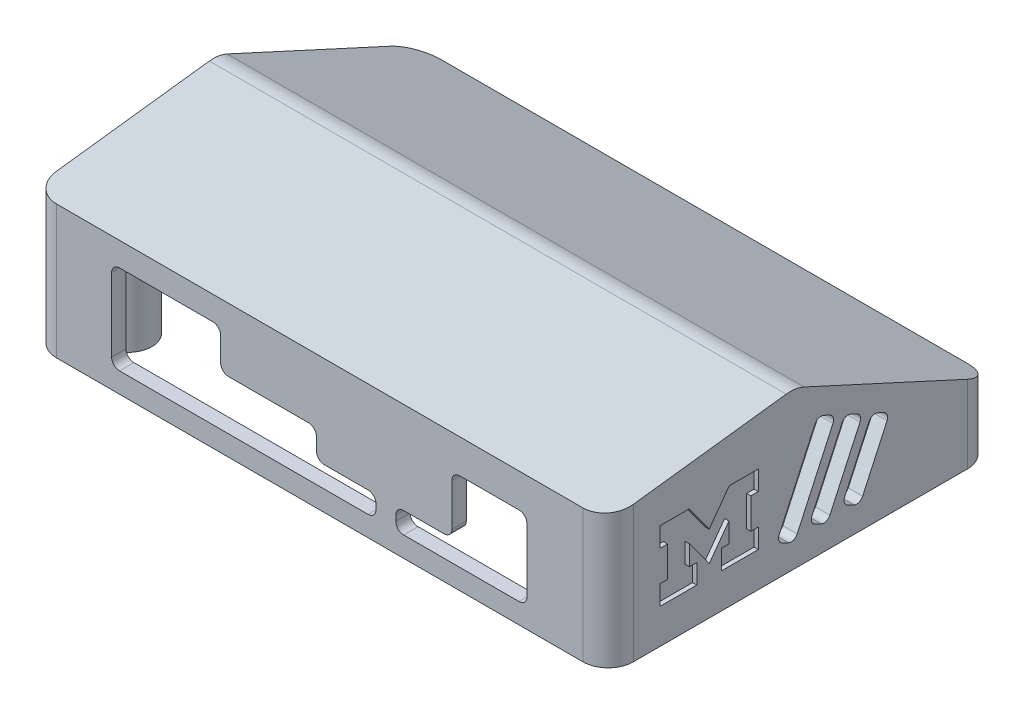
from build123d import *

# Parameters (mm, degrees)
BOSS_EXTRUDE1_DEPTH  = 1.8
BOSS_EXTRUDE3_DEPTH  = 10
CUT_EXTRUDE1_START   = -2.175
CUT_EXTRUDE1_DEPTH   = 2.175
SKETCH5_R            = 2.19
CUT_EXTRUDE2_DEPTH   = 5
BOSS_EXTRUDE4_DEPTH  = 8
BOSS_EXTRUDE5_DEPTH  = 2.175
SKETCH15_W           = 8.25
SKETCH15_H           = 13.5
SKETCH15_W_2         = 8.509
SKETCH15_H_2         = 3.2
SKETCH15_W_3         = 0.491
SKETCH15_W_4         = 5.25
SKETCH15_H_3         = 12
CUT_EXTRUDE3_DEPTH   = 2.175
BOSS_EXTRUDE11_REACH = 97.681
BOSS_EXTRUDE12_DEPTH = 2.175
BOSS_EXTRUDE13_DEPTH = 2.175
CUT_EXTRUDE6_DEPTH   = 97.550219411
FILLET7_R            = 1
FILLET1_R            = 3.8
FILLET2_R            = 3.8
FILLET4_R            = 1.2
BOSS_EXTRUDE9_REACH  = 68.419
BOSS_EXTRUDE9_START  = -3.13
SKETCH20_R           = 3.6
SKETCH20_R_2         = 2.125
CUT_EXTRUDE4_DEPTH   = 97.550219411
SKETCH23_W           = 8.6
SKETCH23_H           = 1.5
SKETCH23_W_2         = 3.9
CUT_EXTRUDE5_DEPTH   = 2.175
BOSS_EXTRUDE14_REACH = 68.419
BOSS_EXTRUDE14_START = -3.13
SKETCH20_4_R         = 3.6
SKETCH20_4_R_2       = 2.125
FILLET8_R            = 5
CUT_EXTRUDE7_DEPTH   = 0.65
BOSS_EXTRUDE16_REACH = 64.045
BOSS_EXTRUDE17_REACH = 64.045


# Read off the part's stored shape, not the designer's step: Cut-Extrude1
with BuildPart() as part:
    # Sketch1 → Boss-Extrude1 (new body)
    with BuildSketch(Plane(origin=(0, 0, 0), x_dir=(1, 0, 0), z_dir=(0, 1, 0))):
        with BuildLine():
            Line((-37.776666667, 21.111111111), (-37.776666667, -27.738888889))
            ThreePointArc((-37.776666667, -27.738888889), (-36.851124095, -29.973346317), (-34.616666667, -30.898888889))
            Line((-34.616666667, -30.898888889), (43.333333333, -30.898888889))
            ThreePointArc((43.333333333, -30.898888889), (45.567790762, -29.973346317), (46.493333333, -27.738888889))
            Line((46.493333333, -27.738888889), (46.493333333, 21.111111111))
            ThreePointArc((46.493333333, 21.111111111), (45.567790762, 23.34556854), (43.333333333, 24.271111111))
            Line((43.333333333, 24.271111111), (-34.616666667, 24.271111111))
            ThreePointArc((-34.616666667, 24.271111111), (-36.851124095, 23.34556854), (-37.776666667, 21.111111111))
        make_face()
        with BuildLine():
            Line((-34.616666667, 23.611111111), (43.333333333, 23.611111111))
            ThreePointArc((43.333333333, 23.611111111), (45.101100286, 22.878878064), (45.833333333, 21.111111111))
            Line((45.833333333, 21.111111111), (45.833333333, -27.738888889))
            ThreePointArc((45.833333333, -27.738888889), (45.101100286, -29.506655842), (43.333333333, -30.238888889))
            Line((43.333333333, -30.238888889), (-34.616666667, -30.238888889))
            ThreePointArc((-34.616666667, -30.238888889), (-36.38443362, -29.506655842), (-37.116666667, -27.738888889))
            Line((-37.116666667, -27.738888889), (-37.116666667, 21.111111111))
            ThreePointArc((-37.116666667, 21.111111111), (-36.38443362, 22.878878064), (-34.616666667, 23.611111111))
        make_face(mode=Mode.SUBTRACT)
    extrude(amount=BOSS_EXTRUDE1_DEPTH)

    # Sketch3 → Boss-Extrude3 (add)
    with BuildSketch(Plane(origin=(0, 1.8, 0), x_dir=(1, 0, 0), z_dir=(0, 1, 0))):
        Polygon((-34.616666667, 25.786111111), (-39.291666667, 25.786111111), (-39.291666667, -32.413888889), (48.008333333, -32.413888889), (48.008333333, 25.786111111), align=None)
        with BuildLine():
            Line((-37.116666667, -27.738888889), (-37.116666667, 21.111111111))
            ThreePointArc((-37.116666667, 21.111111111), (-36.38443362, 22.878878064), (-34.616666667, 23.611111111))
            Line((-34.616666667, 23.611111111), (43.333333333, 23.611111111))
            ThreePointArc((43.333333333, 23.611111111), (45.101100286, 22.878878064), (45.833333333, 21.111111111))
            Line((45.833333333, 21.111111111), (45.833333333, -27.738888889))
            ThreePointArc((45.833333333, -27.738888889), (45.101100286, -29.506655842), (43.333333333, -30.238888889))
            Line((43.333333333, -30.238888889), (-34.616666667, -30.238888889))
            ThreePointArc((-34.616666667, -30.238888889), (-36.38443362, -29.506655842), (-37.116666667, -27.738888889))
        make_face(mode=Mode.SUBTRACT)
    extrude(amount=BOSS_EXTRUDE3_DEPTH)

    # Cut-Extrude1 outline → Cut-Extrude1 (cut)
    with BuildSketch(Plane(origin=(0, 0, -25.786111111), x_dir=(-1, 0, 0), z_dir=(0, 0, -1)).offset(CUT_EXTRUDE1_START)):
        with BuildLine():
            ThreePointArc((11.403122186, 1.8), (7.960666667, 10.45), (4.518211148, 1.8))
            Line((4.518211148, 1.8), (4.518211148, 0))
            Line((4.518211148, 0), (11.403122186, 0))
            Line((11.403122186, 0), (11.403122186, 1.8))
        make_face()
        with BuildLine():
            Line((24.104122186, 0), (24.104122186, 1.8))
            ThreePointArc((24.104122186, 1.8), (20.661666667, 10.45), (17.219211148, 1.8))
            Line((17.219211148, 1.8), (17.219211148, 0))
            Line((17.219211148, 0), (24.104122186, 0))
        make_face()
    extrude(amount=CUT_EXTRUDE1_DEPTH, mode=Mode.SUBTRACT)

    # Sketch5 → Cut-Extrude2 (cut)
    with BuildSketch(Plane(origin=(0, 0, -25.786111111), x_dir=(-1, 0, 0), z_dir=(0, 0, -1))):
        with Locations((-17.338333333, 8.55)):
            Circle(SKETCH5_R)
        with Locations((-4.658333333, 8.55)):
            Circle(SKETCH5_R)
    extrude(amount=-CUT_EXTRUDE2_DEPTH, mode=Mode.SUBTRACT)

    # Sketch6 → Boss-Extrude4 (add)
    with BuildSketch(Plane(origin=(0, 11.8, 0), x_dir=(1, 0, 0), z_dir=(0, 1, 0))):
        with BuildLine():
            Line((-37.116666667, -27.738888889), (-37.116666667, -3.313888889))
            Line((-37.116666667, -3.313888889), (-39.291666667, -3.313888889))
            Line((-39.291666667, -3.313888889), (-39.291666667, -28.613888889))
            Line((-39.291666667, -28.613888889), (-39.291666667, -32.413888889))
            Line((-39.291666667, -32.413888889), (-35.491666667, -32.413888889))
            Line((-35.491666667, -32.413888889), (44.208333333, -32.413888889))
            Line((44.208333333, -32.413888889), (48.008333333, -32.413888889))
            Line((48.008333333, -32.413888889), (48.008333333, -28.613888889))
            Line((48.008333333, -28.613888889), (48.008333333, -3.313888889))
            Line((48.008333333, -3.313888889), (45.833333333, -3.313888889))
            Line((45.833333333, -3.313888889), (45.833333333, -27.738888889))
            ThreePointArc((45.833333333, -27.738888889), (45.101100286, -29.506655842), (43.333333333, -30.238888889))
            Line((43.333333333, -30.238888889), (-34.616666667, -30.238888889))
            ThreePointArc((-34.616666667, -30.238888889), (-36.38443362, -29.506655842), (-37.116666667, -27.738888889))
        make_face()
    extrude(amount=BOSS_EXTRUDE4_DEPTH)

    # Sketch7 → Boss-Extrude5 (add)
    with BuildSketch(Plane(origin=(0, 19.8, 0), x_dir=(1, 0, 0), z_dir=(0, 1, 0))):
        Polygon((-39.291666667, -30.238888889), (48.008333333, -30.238888889), (48.008333333, -31.3687594), (48.008333333, -32.413888889), (44.208333333, -32.413888889), (-35.491666667, -32.413888889), (-39.291666667, -32.413888889), (-39.291666667, -31.3687594), align=None)
    extrude(amount=BOSS_EXTRUDE5_DEPTH)

    # Sketch15 → Cut-Extrude3 (cut)
    with BuildSketch(Plane.XY.offset(32.413888889)):
        with Locations((-23.007666667, 11.6175)):
            Rectangle(SKETCH15_W, SKETCH15_H)
        Polygon((-18.882666667, 4.8675), (-10.632666667, 4.8675), (-10.632666667, 12.3675), (-10.632666667, 18.3675), (-18.882666667, 18.3675), align=None)
        Polygon((-10.632666667, 4.8675), (3.867333333, 4.8675), (3.867333333, 8.0675), (3.867333333, 12.3675), (-10.632666667, 12.3675), align=None)
        with Locations((8.612833333, 6.4675)):
            Rectangle(SKETCH15_W_2, SKETCH15_H_2)
        with Locations((4.112833333, 6.4675)):
            Rectangle(SKETCH15_W_3, SKETCH15_H_2)
        Polygon((15.867333333, 8.0675), (15.867333333, 4.8675), (24.367333333, 4.8675), (25.219533333, 4.8675), (30.469533333, 4.8675), (30.469533333, 16.8675), (25.219533333, 16.8675), (24.367333333, 16.8675), (24.367333333, 8.0675), align=None)
        with Locations((33.094533333, 10.8675)):
            Rectangle(SKETCH15_W_4, SKETCH15_H_3)
        with Locations((33.094533333, 10.8675)):
            Rectangle(SKETCH15_W_4, SKETCH15_H_3)
    extrude(amount=-CUT_EXTRUDE3_DEPTH, mode=Mode.SUBTRACT)

    # Boss-Extrude11: up to this face of the body (flat: up to its plane)
    boss_extrude11_end = Plane(part.part.faces().sort_by_distance((48.008333333, 9.43790347, 7.608733432))[0])
    # Sketch24 → Boss-Extrude11 (add, up to the picked face)
    with BuildSketch(Plane.ZY.offset(39.291666667), mode=Mode.PRIVATE) as boss_extrude11_sk1:
        Polygon((32.146007123, 19.816559739), (4.397287352, 23.26042436), (-20.572039568, 11.8), (-25.786111111, 11.8), (4.051768383, 25.494993145), (32.413888889, 21.975), (32.413888889, 19.816559739), align=None)
    boss_extrude11_tool1 = split(extrude(boss_extrude11_sk1.sketch, amount=-BOSS_EXTRUDE11_REACH, mode=Mode.PRIVATE), bisect_by=boss_extrude11_end, keep=Keep.BOTH, mode=Mode.PRIVATE)
    add(boss_extrude11_tool1.solids().sort_by(Axis((-39.291667, 22.131836, 18.345286), (1, 0, 0)))[0])

    # Sketch28 → Boss-Extrude12 (add)
    with BuildSketch(Plane.ZY.offset(39.291666667)):
        Polygon((-20.572039568, 11.8), (4.397287352, 23.26042436), (30.238888889, 20.053250191), (30.238888889, 19.8), (3.313888889, 19.8), (3.313888889, 11.8), align=None)
    extrude(amount=-BOSS_EXTRUDE12_DEPTH)

    # Sketch29 → Boss-Extrude13 (add)
    with BuildSketch(Plane(origin=(48.008333333, 0, 0), x_dir=(0, 0, -1), z_dir=(1, 0, 0))):
        Polygon((-30.238888889, 20.053250191), (-30.238888889, 19.8), (-3.313888889, 19.8), (-3.313888889, 11.8), (20.572039568, 11.8), (-4.397287352, 23.26042436), align=None)
    extrude(amount=-BOSS_EXTRUDE13_DEPTH)

    # Sketch32 → Cut-Extrude6 (cut, through all)
    with BuildSketch(Plane(origin=(48.008333333, 0, 0), x_dir=(0, 0, -1), z_dir=(1, 0, 0))):
        Polygon((2.025914345, 18.864684215), (-0.7006118, 20.116105479), (-6.946522085, 6.507868042), (-4.21999594, 5.256446778), align=None)
        Polygon((0.731359478, 5.256446778), (6.115703563, 16.98755232), (3.389177418, 18.238973584), (-1.995166668, 6.507868042), align=None)
        Polygon((2.95618875, 6.507868042), (7.478966636, 16.361841688), (10.205492781, 15.110420424), (5.682714895, 5.256446778), align=None)
    extrude(amount=-CUT_EXTRUDE6_DEPTH, mode=Mode.SUBTRACT)

    # Fillet7
    fillet7_edges = [part.edges().sort_by_distance(p)[0] for p in [
        (46.920833333, 18.864684215, -2.025914345),
        (46.920833333, 5.256446778, 4.21999594),
        (46.920833333, 6.507868042, 6.946522085),
        (46.920833333, 20.116105479, 0.7006118),
        (-38.204166667, 18.864684215, -2.025914345),
        (-38.204166667, 5.256446778, 4.21999594),
        (-38.204166667, 6.507868042, 6.946522085),
        (-38.204166667, 20.116105479, 0.7006118),
        (46.920833333, 16.98755232, -6.115703563),
        (46.920833333, 5.256446778, -0.731359478),
        (46.920833333, 6.507868042, 1.995166668),
        (46.920833333, 18.238973584, -3.389177418),
        (-38.204166667, 16.98755232, -6.115703563),
        (-38.204166667, 5.256446778, -0.731359478),
        (-38.204166667, 6.507868042, 1.995166668),
        (-38.204166667, 18.238973584, -3.389177418),
        (46.920833333, 6.507868042, -2.95618875),
        (46.920833333, 16.361841688, -7.478966636),
        (46.920833333, 15.110420424, -10.205492781),
        (46.920833333, 5.256446778, -5.682714895),
        (-38.204166667, 6.507868042, -2.95618875),
        (-38.204166667, 16.361841688, -7.478966636),
        (-38.204166667, 15.110420424, -10.205492781),
        (-38.204166667, 5.256446778, -5.682714895),
    ]]
    fillet(fillet7_edges, radius=FILLET7_R)

    # Fillet1
    fillet1_edges = [part.edges().sort_by_distance(p)[0] for p in [
        (-39.291666667, 11.8875, 32.413888889),
        (48.008333333, 11.8875, 32.413888889),
    ]]
    fillet(fillet1_edges, radius=FILLET1_R)

    # Fillet2
    fillet2_edges = [part.edges().sort_by_distance(p)[0] for p in [
        (-39.291666667, 6.8, -25.786111111),
        (48.008333333, 6.8, -25.786111111),
    ]]
    fillet(fillet2_edges, radius=FILLET2_R)

    # Fillet4
    fillet4_edges = [part.edges().sort_by_distance(p)[0] for p in [
        (-27.132666667, 18.3675, 31.326388889),
        (-10.632666667, 18.3675, 31.326388889),
        (-10.632666667, 12.3675, 31.326388889),
        (3.867333333, 12.3675, 31.326388889),
        (3.867333333, 8.0675, 31.326388889),
        (12.867333333, 8.0675, 31.326388889),
        (12.867333333, 4.8675, 31.326388889),
        (-27.132666667, 4.8675, 31.326388889),
        (35.719533333, 4.8675, 31.326388889),
        (15.867333333, 4.8675, 31.326388889),
        (15.867333333, 8.0675, 31.326388889),
        (24.367333333, 8.0675, 31.326388889),
        (24.367333333, 16.8675, 31.326388889),
        (35.719533333, 16.8675, 31.326388889),
    ]]
    fillet(fillet4_edges, radius=FILLET4_R)

    # Boss-Extrude9: up to this plane
    boss_extrude9_end = Plane(origin=(107.797904642, 19.816559739, 32.146007123), z_dir=(0, -0.9923863268188609, -0.12316403023192016))
    # Sketch20 → Boss-Extrude9 (add, up to the surface)
    with BuildSketch(Plane.XZ.offset(BOSS_EXTRUDE9_START), mode=Mode.PRIVATE) as boss_extrude9_sk1:
        with Locations(Location((40.708333333, 25.063888889, 0), (0, 0, 270))):
            Circle(SKETCH20_R)
        with Locations(Location((40.708333333, 25.063888889, 0), (0, 0, 270))):
            Circle(SKETCH20_R_2, mode=Mode.SUBTRACT)
    boss_extrude9_tool1 = split(extrude(boss_extrude9_sk1.sketch, amount=-BOSS_EXTRUDE9_REACH, mode=Mode.PRIVATE), bisect_by=boss_extrude9_end, keep=Keep.BOTH, mode=Mode.PRIVATE)
    add(boss_extrude9_tool1.solids().sort_by_distance((40.708333, 3.13, 28.562066))[0])
    # Sketch20 → Boss-Extrude9 (add, up to the surface)
    with BuildSketch(Plane.XZ.offset(BOSS_EXTRUDE9_START), mode=Mode.PRIVATE) as boss_extrude9_sk2:
        with Locations(Location((-31.991666667, 25.063888889, 0), (0, 0, 270))):
            Circle(SKETCH20_R)
        with Locations(Location((-31.991666667, 25.063888889, 0), (0, 0, 270))):
            Circle(SKETCH20_R_2, mode=Mode.SUBTRACT)
    boss_extrude9_tool2 = split(extrude(boss_extrude9_sk2.sketch, amount=-BOSS_EXTRUDE9_REACH, mode=Mode.PRIVATE), bisect_by=boss_extrude9_end, keep=Keep.BOTH, mode=Mode.PRIVATE)
    add(boss_extrude9_tool2.solids().sort_by_distance((-31.991667, 3.13, 28.562066))[0])

    # Sketch22 → Cut-Extrude4 (cut, through all)
    with BuildSketch(Plane.ZY.offset(39.291666667)):
        Polygon((28.613888889, 1.8), (37.265614347, 1.8), (37.265614347, 0), (-27.033676469, 0), (-27.033676469, 1.8), align=None)
    extrude(amount=-CUT_EXTRUDE4_DEPTH, mode=Mode.SUBTRACT)

    # Sketch23 → Cut-Extrude5 (cut)
    with BuildSketch(Plane.ZY.offset(39.291666667)):
        with Locations((-0.986111111, 2.55)):
            Rectangle(SKETCH23_W, SKETCH23_H)
        with Locations((5.263888889, 2.55)):
            Rectangle(SKETCH23_W_2, SKETCH23_H)
    extrude(amount=-CUT_EXTRUDE5_DEPTH, mode=Mode.SUBTRACT)

    # Sketch20<4> → Boss-Extrude14 (add, up to next)
    with BuildSketch(Plane.XZ.offset(BOSS_EXTRUDE14_START), mode=Mode.PRIVATE) as boss_extrude14_sk1:
        with Locations(Location((40.708333333, -18.436111111, 0), (0, 0, 270))):
            Circle(SKETCH20_4_R)
        with Locations(Location((40.708333333, -18.436111111, 0), (0, 0, 270))):
            Circle(SKETCH20_4_R_2, mode=Mode.SUBTRACT)
    boss_extrude14_tool1 = extrude(boss_extrude14_sk1.sketch, amount=-BOSS_EXTRUDE14_REACH, mode=Mode.PRIVATE) - part.part
    # Sketch20<4> → Boss-Extrude14 (add, up to next)
    with BuildSketch(Plane.XZ.offset(BOSS_EXTRUDE14_START), mode=Mode.PRIVATE) as boss_extrude14_sk2:
        with Locations(Location((-31.991666667, -18.436111111, 0), (0, 0, 270))):
            Circle(SKETCH20_4_R)
        with Locations(Location((-31.991666667, -18.436111111, 0), (0, 0, 270))):
            Circle(SKETCH20_4_R_2, mode=Mode.SUBTRACT)
    boss_extrude14_tool2 = extrude(boss_extrude14_sk2.sketch, amount=-BOSS_EXTRUDE14_REACH, mode=Mode.PRIVATE) - part.part
    add(boss_extrude14_tool1.solids().sort_by_distance((40.708333, 3.13, -14.937934))[0])
    add(boss_extrude14_tool2.solids().sort_by_distance((-31.991667, 3.13, -14.937934))[0])

    # Fillet8
    fillet8_edges = [part.edges().sort_by_distance(p)[0] for p in [
        (4.358333333, 25.494993145, 4.051768383),
    ]]
    fillet(fillet8_edges, radius=FILLET8_R)

    # Sketch33 → Cut-Extrude7 (cut)
    with BuildSketch(Plane(origin=(48.008333333, 0, 0), x_dir=(0, 0, -1), z_dir=(1, 0, 0))):
        Polygon((-24.546815276, 17.617773701), (-24.546815276, 14.657773701), (-23.426815276, 14.657773701), (-23.426815276, 10.017773701), (-24.546815276, 10.017773701), (-24.546815276, 7.057773701), (-18.994815276, 7.057773701), (-18.994815276, 10.017773701), (-20.114815276, 10.017773701), (-20.114815276, 13.025773701), (-17.122815276, 8.931457911), (-14.130815276, 13.025773701), (-14.130815276, 10.017773701), (-15.250815276, 10.017773701), (-15.250815276, 7.057773701), (-9.698815276, 7.057773701), (-9.698815276, 10.017773701), (-10.818815276, 10.017773701), (-10.818815276, 14.657773701), (-9.698815276, 14.657773701), (-9.698815276, 17.617773701), (-14.082815276, 17.617773701), (-17.122815276, 13.457773701), (-20.162815276, 17.617773701), align=None)
    extrude(amount=-CUT_EXTRUDE7_DEPTH, mode=Mode.SUBTRACT)

    # Boss-Extrude16: up to this plane
    boss_extrude16_end = Plane(origin=(107.797904642, 19.816559739, 32.146007123), z_dir=(0, -0.9923863268188609, -0.12316403023192016))
    # Sketch34 → Boss-Extrude16 (add, up to the surface)
    with BuildSketch(Plane.XZ.offset(-3.13), mode=Mode.PRIVATE) as boss_extrude16_sk1:
        Polygon((-34.770532091, 26.458101482), (-33.346324463, 27.862249848), (-36.293334004, 30.851359525), (-37.717541632, 29.447211159), align=None)
    boss_extrude16_tool1 = split(extrude(boss_extrude16_sk1.sketch, amount=-BOSS_EXTRUDE16_REACH, mode=Mode.PRIVATE), bisect_by=boss_extrude16_end, keep=Keep.BOTH, mode=Mode.PRIVATE)
    add(boss_extrude16_tool1.solids().sort_by_distance((-35.531933, 3.13, 28.654731))[0])
    # Sketch34 → Boss-Extrude16 (add, up to the surface)
    with BuildSketch(Plane.XZ.offset(-3.13), mode=Mode.PRIVATE) as boss_extrude16_sk2:
        Polygon((45.01000067, 30.851359525), (42.06299113, 27.862249848), (43.487198758, 26.458101482), (46.434208298, 29.447211159), align=None)
    boss_extrude16_tool2 = split(extrude(boss_extrude16_sk2.sketch, amount=-BOSS_EXTRUDE16_REACH, mode=Mode.PRIVATE), bisect_by=boss_extrude16_end, keep=Keep.BOTH, mode=Mode.PRIVATE)
    add(boss_extrude16_tool2.solids().sort_by_distance((44.2486, 3.13, 28.654731))[0])

    # Sketch35 → Boss-Extrude17 (add, up to next)
    with BuildSketch(Plane.XZ.offset(-3.13), mode=Mode.PRIVATE) as boss_extrude17_sk1:
        Polygon((-33.902920828, -20.383770113), (-34.616666667, -19.683365318), (-37.70835005, -22.833937908), (-36.280858372, -24.234747499), (-33.189174989, -21.084174909), align=None)
    boss_extrude17_tool1 = extrude(boss_extrude17_sk1.sketch, amount=-BOSS_EXTRUDE17_REACH, mode=Mode.PRIVATE) - part.part
    # Sketch35 → Boss-Extrude17 (add, up to next)
    with BuildSketch(Plane.XZ.offset(-3.13), mode=Mode.PRIVATE) as boss_extrude17_sk2:
        Polygon((46.425016716, -22.833937908), (43.333333333, -19.683365318), (42.619587494, -20.383770113), (41.905841655, -21.084174909), (44.997525038, -24.234747499), align=None)
    boss_extrude17_tool2 = extrude(boss_extrude17_sk2.sketch, amount=-BOSS_EXTRUDE17_REACH, mode=Mode.PRIVATE) - part.part
    add(boss_extrude17_tool1.solids().sort_by_distance((-35.448763, 3.13, -21.959056))[0])
    add(boss_extrude17_tool2.solids().sort_by_distance((44.165429, 3.13, -21.959056))[0])


solid = part.part
